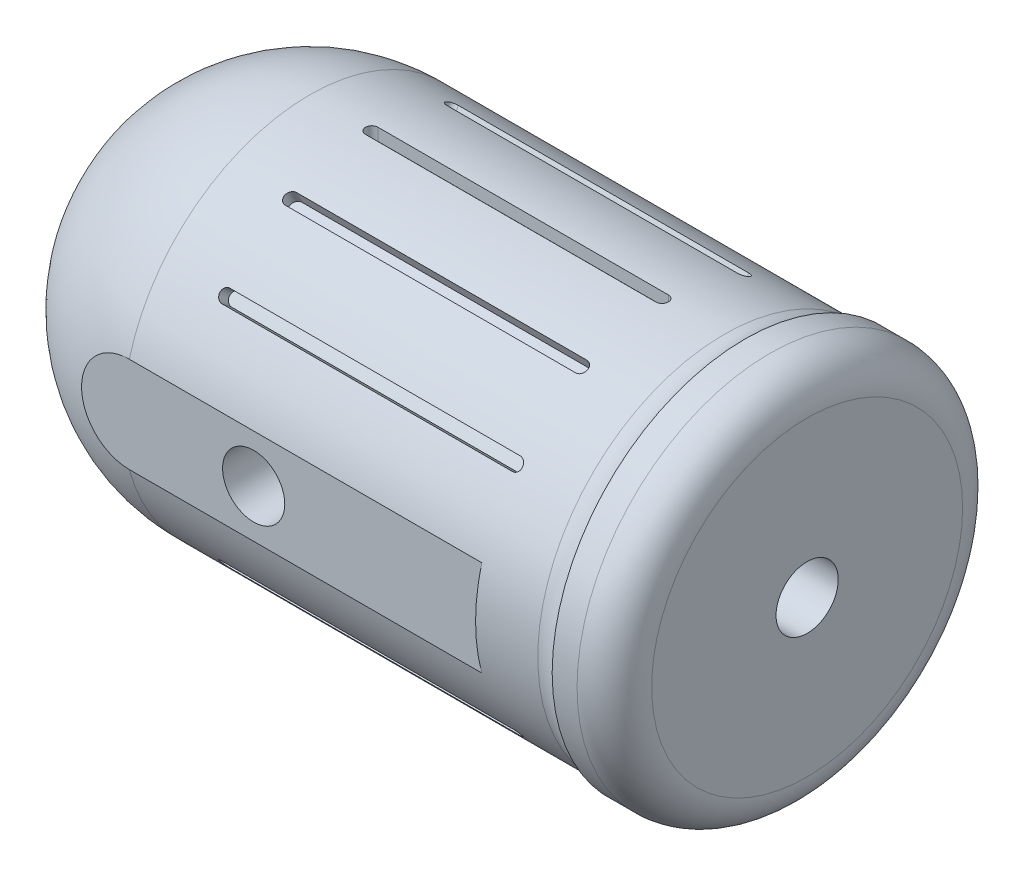
from build123d import *
from OCP.BRepFilletAPI import BRepFilletAPI_MakeFillet

# Parameters (mm, degrees)
FILLET1_R          = 3
SKETCH3_R          = 2.5
CUT_EXTRUDE1_DEPTH = 5
CUT_EXTRUDE2_START = 15
SKETCH4_R          = 2.5
CUT_EXTRUDE2_DEPTH = 5
CUT_EXTRUDE3_START = 15
CUT_EXTRUDE3_DEPTH = 1
CIRPATTERN1_COUNT  = 14
SKETCH7_W          = 44
SKETCH7_H          = 3.591252266
CUT_EXTRUDE5_DEPTH = 46.612498321
CUT_EXTRUDE6_START = -15
SKETCH8_R          = 5
SKETCH8_R_2        = 3
CUT_EXTRUDE6_DEPTH = 10
FILLET2_R1         = 1
FILLET2_R2         = 2


with BuildPart() as part:
    # Sketch1 → Revolve1 (revolve)
    with BuildSketch(Plane.XY, mode=Mode.PRIVATE) as revolve1_sk:
        with BuildLine():
            Line((40, 15.5), (35, 15.5))
            Line((35, 15.5), (35, 15))
            Line((35, 15), (0, 15))
            ThreePointArc((0, 15), (-10.606601718, 10.606601718), (-15, 0))
            Line((-15, 0), (40, 0))
            Line((40, 0), (40, 15.5))
        make_face()
    revolve(revolve1_sk.sketch.rotate(Axis((40, 0, 0), (-1, 0, 0)), 90), axis=Axis((40, 0, 0), (-1, 0, 0)))

    # Fillet1
    # the kernel refuses this fillet: 3 mm, written as the material it adds along each edge
    with BuildSketch(Plane(origin=(35, 0, 0), x_dir=(0, 0, -1), z_dir=(0, 1, 0))) as fillet1_piece_1:
        with BuildLine():
            CenterArc((18, 1.658312395), FILLET1_R, 180, 33.557309762)
            Line((15, 1.658312395), (15, 0))
            Line((15, 0), (15.5, 0))
        make_face()
    revolve(axis=Axis((35, 0, 0), (-1, 0, 0)))
    # the kernel refuses this fillet: 3 mm, written as the material it takes off along each edge
    with BuildSketch(Plane(origin=(40, 0, 0), x_dir=(0, 0, -1), z_dir=(0, 1, 0))) as fillet1_2_piece_1:
        with BuildLine():
            CenterArc((15.5 - FILLET1_R, FILLET1_R), FILLET1_R, 270, 90)
            Line((15.5 - FILLET1_R, 0), (15.5, 0))
            Line((15.5, 0), (15.5, FILLET1_R))
        make_face()
    revolve(axis=Axis((40, 0, 0), (-1, 0, 0)), mode=Mode.SUBTRACT)

    # Sketch3 → Cut-Extrude1 (cut)
    with BuildSketch(Plane(origin=(40, 0, 0), x_dir=(0, 0, -1), z_dir=(1, 0, 0))):
        Circle(SKETCH3_R)
    extrude(amount=-CUT_EXTRUDE1_DEPTH, mode=Mode.SUBTRACT)

    # Sketch4 → Cut-Extrude2 (cut)
    with BuildSketch(Plane.XY.offset(CUT_EXTRUDE2_START)):
        with Locations((10, 0)):
            Circle(SKETCH4_R)
    cut_extrude2 = extrude(amount=-CUT_EXTRUDE2_DEPTH, mode=Mode.SUBTRACT)

    # Mirror1: Cut-Extrude2 across plane
    add(cut_extrude2.mirror(Plane.XY), mode=Mode.SUBTRACT)

    # Sketch5 → Cut-Extrude3 (cut)
    with BuildSketch(Plane(origin=(0, 0, 0), x_dir=(1, 0, 0), z_dir=(0, 1, 0)).offset(CUT_EXTRUDE3_START)):
        with BuildLine():
            Line((5, 0.5), (28.341687605, 0.5))
            ThreePointArc((28.341687605, 0.5), (28.841687605, 0), (28.341687605, -0.5))
            Line((28.341687605, -0.5), (5, -0.5))
            ThreePointArc((5, -0.5), (4.5, 0), (5, 0.5))
        make_face()
    cut_extrude3 = extrude(amount=-CUT_EXTRUDE3_DEPTH, mode=Mode.SUBTRACT)

    # CirPattern1: Cut-Extrude3 ×14 about axis, 4 skipped
    cirpattern1_axis = Axis((0, 0, 0), (-1, 0, 0))
    add([cut_extrude3.rotate(cirpattern1_axis, i * 360 / CIRPATTERN1_COUNT) for i in range(1, CIRPATTERN1_COUNT) if i not in (3, 4, 10, 11)], mode=Mode.SUBTRACT)

    # Sketch7 → Cut-Extrude5 (cut, symmetric)
    with BuildSketch(Plane(origin=(0, 0, 0), x_dir=(1, 0, 0), z_dir=(0, 1, 0))):
        with Locations((6.341687605, 16.295626133)):
            Rectangle(SKETCH7_W, SKETCH7_H)
    cut_extrude5 = extrude(amount=CUT_EXTRUDE5_DEPTH, both=True, mode=Mode.SUBTRACT)

    # Mirror2: Cut-Extrude5 across plane
    add(cut_extrude5.mirror(Plane.XY), mode=Mode.SUBTRACT)

    # Sketch8 → Cut-Extrude6 (cut)
    with BuildSketch(Plane(origin=(0, 0, 0), x_dir=(0, 0, -1), z_dir=(1, 0, 0)).offset(CUT_EXTRUDE6_START)):
        Circle(SKETCH8_R)
        Circle(SKETCH8_R_2, mode=Mode.SUBTRACT)
    extrude(amount=CUT_EXTRUDE6_DEPTH, mode=Mode.SUBTRACT)

    # Fillet2: one fillet with a radius per group of edges: ONE call of the kernel's fillet builder (fillet() takes one radius for all edges)
    fillet2_edges_1 = [part.edges().sort_by_distance(p)[0] for p in [
        (-14.696938457, 0, 3),
    ]]
    fillet2_edges_2 = [part.edges().sort_by_distance(p)[0] for p in [
        (-14.142135624, 0, 5),
    ]]
    fillet2 = BRepFilletAPI_MakeFillet(part.part.solid().wrapped)
    for e in fillet2_edges_1:
        fillet2.Add(FILLET2_R1, e.wrapped)
    for e in fillet2_edges_2:
        fillet2.Add(FILLET2_R2, e.wrapped)
    add(Compound.cast(fillet2.Shape()), mode=Mode.REPLACE)


solid = part.part
